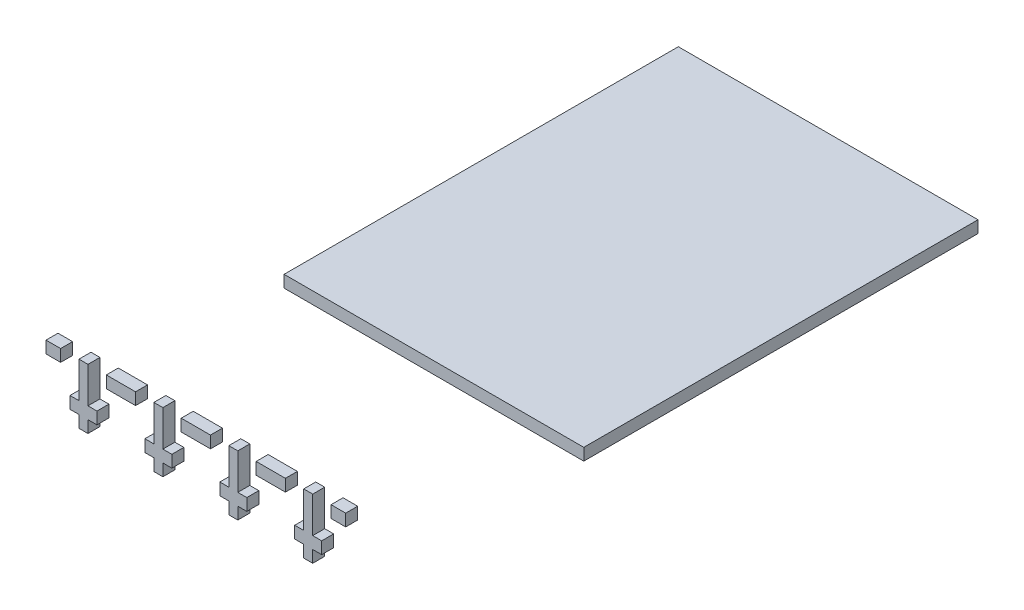
from build123d import *

# Parameters (mm, degrees)
SKETCH3_W             = 4.882352942
SKETCH3_H             = 4
BOSS_EXTRUDE2_DEPTH   = 4
SKETCH3_W_2           = 3
BOSS_EXTRUDE2_2_DEPTH = 4
SKETCH3_W_3           = 9.764705883
BOSS_EXTRUDE2_3_DEPTH = 4
BOSS_EXTRUDE2_4_DEPTH = 4
BOSS_EXTRUDE2_5_DEPTH = 4
BOSS_EXTRUDE2_6_DEPTH = 4
BOSS_EXTRUDE2_7_DEPTH = 4
BOSS_EXTRUDE2_8_DEPTH = 4
SKETCH3_W_4           = 4.882352941
BOSS_EXTRUDE2_9_DEPTH = 4
SKETCH3_6_W           = 3
SKETCH3_6_H           = 4
BOSS_EXTRUDE4_DEPTH   = 16
BOSS_EXTRUDE5_START   = -12
SKETCH3_7_W           = 3
SKETCH3_7_H           = 4
BOSS_EXTRUDE5_DEPTH   = 4
SKETCH4_W             = 100
SKETCH4_H             = 131.543597655
BOSS_EXTRUDE6_DEPTH   = 4


with BuildPart() as part:
    # Sketch3 → Boss-Extrude2 (new body)
    with BuildSketch(Plane(origin=(0, 0, 0), x_dir=(1, 0, 0), z_dir=(0, 1, 0))):
        with Locations((-14.423551679, -220.31766228)):
            Rectangle(SKETCH3_W, SKETCH3_H)
    extrude(amount=BOSS_EXTRUDE2_DEPTH)


with BuildPart() as body_2:
    # Sketch3 → Boss-Extrude2 2 (new body)
    with BuildSketch(Plane(origin=(0, 0, 0), x_dir=(1, 0, 0), z_dir=(0, 1, 0))):
        with Locations((-4.36472815, -220.31766228)):
            Rectangle(SKETCH3_W_2, SKETCH3_H)
    extrude(amount=BOSS_EXTRUDE2_2_DEPTH)



with BuildPart() as body_3:
    # Sketch3 → Boss-Extrude2 3 (new body)
    with BuildSketch(Plane(origin=(0, 0, 0), x_dir=(1, 0, 0), z_dir=(0, 1, 0))):
        with Locations((8.135271851, -220.31766228)):
            Rectangle(SKETCH3_W_3, SKETCH3_H)
    extrude(amount=BOSS_EXTRUDE2_3_DEPTH)


with BuildPart() as body_4:
    # Sketch3 → Boss-Extrude2 4 (new body)
    with BuildSketch(Plane(origin=(0, 0, 0), x_dir=(1, 0, 0), z_dir=(0, 1, 0))):
        with Locations((20.63527185, -220.31766228)):
            Rectangle(SKETCH3_W_2, SKETCH3_H)
    extrude(amount=BOSS_EXTRUDE2_4_DEPTH)


with BuildPart() as body_5:
    # Sketch3 → Boss-Extrude2 5 (new body)
    with BuildSketch(Plane(origin=(0, 0, 0), x_dir=(1, 0, 0), z_dir=(0, 1, 0))):
        with Locations((33.135271851, -220.31766228)):
            Rectangle(SKETCH3_W_3, SKETCH3_H)
    extrude(amount=BOSS_EXTRUDE2_5_DEPTH)


with BuildPart() as body_6:
    # Sketch3 → Boss-Extrude2 6 (new body)
    with BuildSketch(Plane(origin=(0, 0, 0), x_dir=(1, 0, 0), z_dir=(0, 1, 0))):
        with Locations((45.63527185, -220.31766228)):
            Rectangle(SKETCH3_W_2, SKETCH3_H)
    extrude(amount=BOSS_EXTRUDE2_6_DEPTH)


with BuildPart() as body_7:
    # Sketch3 → Boss-Extrude2 7 (new body)
    with BuildSketch(Plane(origin=(0, 0, 0), x_dir=(1, 0, 0), z_dir=(0, 1, 0))):
        with Locations((58.135271851, -220.31766228)):
            Rectangle(SKETCH3_W_3, SKETCH3_H)
    extrude(amount=BOSS_EXTRUDE2_7_DEPTH)


with BuildPart() as body_8:
    # Sketch3 → Boss-Extrude2 8 (new body)
    with BuildSketch(Plane(origin=(0, 0, 0), x_dir=(1, 0, 0), z_dir=(0, 1, 0))):
        with Locations((70.63527185, -220.31766228)):
            Rectangle(SKETCH3_W_2, SKETCH3_H)
    extrude(amount=BOSS_EXTRUDE2_8_DEPTH)


with BuildPart() as body_9:
    # Sketch3 → Boss-Extrude2 9 (new body)
    with BuildSketch(Plane(origin=(0, 0, 0), x_dir=(1, 0, 0), z_dir=(0, 1, 0))):
        with Locations((80.694095379, -220.31766228)):
            Rectangle(SKETCH3_W_4, SKETCH3_H)
    extrude(amount=BOSS_EXTRUDE2_9_DEPTH)


with BuildPart() as body_2_1:
    add(body_2.part)

    add(body_4.part)  # Boss-Extrude4 merges body 4

    add(body_6.part)  # Boss-Extrude4 merges body 6

    add(body_8.part)  # Boss-Extrude4 merges body 8
    # Sketch3<6> → Boss-Extrude4 (add)
    with BuildSketch(Plane(origin=(0, 0, 0), x_dir=(1, 0, 0), z_dir=(0, 1, 0))):
        with Locations((-4.36472815, -220.31766228)):
            Rectangle(SKETCH3_6_W, SKETCH3_6_H)
        with Locations((20.63527185, -220.31766228)):
            Rectangle(SKETCH3_6_W, SKETCH3_6_H)
        with Locations((45.63527185, -220.31766228)):
            Rectangle(SKETCH3_6_W, SKETCH3_6_H)
        with Locations((70.63527185, -220.31766228)):
            Rectangle(SKETCH3_6_W, SKETCH3_6_H)
    extrude(amount=-BOSS_EXTRUDE4_DEPTH)

    # Sketch3<7> → Boss-Extrude5 (add)
    with BuildSketch(Plane(origin=(0, 0, 0), x_dir=(1, 0, 0), z_dir=(0, 1, 0)).offset(BOSS_EXTRUDE5_START)):
        with Locations((-7.36472815, -220.31766228)):
            Rectangle(SKETCH3_7_W, SKETCH3_7_H)
        with Locations((-1.36472815, -220.31766228)):
            Rectangle(SKETCH3_7_W, SKETCH3_7_H)
        with Locations((17.63527185, -220.31766228)):
            Rectangle(SKETCH3_7_W, SKETCH3_7_H)
        with Locations((23.63527185, -220.31766228)):
            Rectangle(SKETCH3_7_W, SKETCH3_7_H)
        with Locations((42.63527185, -220.31766228)):
            Rectangle(SKETCH3_7_W, SKETCH3_7_H)
        with Locations((48.63527185, -220.31766228)):
            Rectangle(SKETCH3_7_W, SKETCH3_7_H)
        with Locations((67.63527185, -220.31766228)):
            Rectangle(SKETCH3_7_W, SKETCH3_7_H)
        with Locations((73.63527185, -220.31766228)):
            Rectangle(SKETCH3_7_W, SKETCH3_7_H)
    extrude(amount=BOSS_EXTRUDE5_DEPTH)


with BuildPart() as body_7_2:
    # Sketch4 → Boss-Extrude6 (new body)
    with BuildSketch(Plane(origin=(0, 0, 0), x_dir=(1, 0, 0), z_dir=(0, 1, 0))):
        with Locations((53.84559612, -97.809820722)):
            Rectangle(SKETCH4_W, SKETCH4_H)
    extrude(amount=BOSS_EXTRUDE6_DEPTH)


solid = Compound([part.part, body_3.part, body_5.part, body_7.part, body_9.part, body_2_1.part, body_7_2.part])
